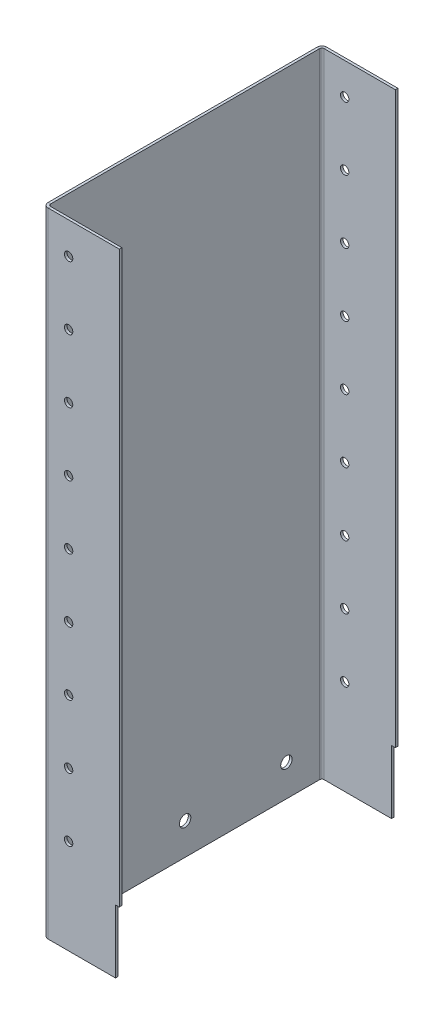
from build123d import *

# Parameters (mm, degrees)
SKETCH_1_W                         = 2
SKETCH_1_H                         = 500
SM_BASE_FLANGE_1_DEPTH             = 220
SM_EDGE_FLANGE_1_STRIP_W           = 11.6
SM_EDGE_FLANGE_1_STRIP_H           = 2
SM_EDGE_FLANGE_1_STRIP_CUT_DEPTH   = 500
SM_EDGE_FLANGE_1_STRIP_2_W         = 11.6
SM_EDGE_FLANGE_1_STRIP_2_H         = 2
SM_EDGE_FLANGE_1_STRIP_CUT_2_DEPTH = 500
SM_EDGE_FLANGE_1_DEPTH             = 500
SM_EDGE_FLANGE_1_BEND_DEPTH        = 500
SKETCH_10_W                        = 3
SKETCH_10_H                        = 50
CUT_EXTRUDE_1_DEPTH                = 550.545266561
HOLE_WIZARD_M81_D                  = 9
HOLE_WIZARD_M81_DEPTH              = 5
HOLE_WIZARD_M81_TIP                = 2.703872786
HOLE_WIZARD_M61_D                  = 6.6


# Sheet-metal steps are written as plain solids
with BuildPart() as part:
    # Sketch 1 → Базовая кромка1 (new body)
    with BuildSketch(Plane.XY):
        with Locations((1, 250)):
            Rectangle(SKETCH_1_W, SKETCH_1_H)
    extrude(amount=SM_BASE_FLANGE_1_DEPTH)

    # Ребро-кромка1 strip (across the edge) → Ребро-кромка1 strip cut (cut)
    with BuildSketch(Plane(origin=(2, 0, 0), x_dir=(0, 0, 1), z_dir=(0, 1, 0))):
        with Locations((-2, -1)):
            Rectangle(SM_EDGE_FLANGE_1_STRIP_W, SM_EDGE_FLANGE_1_STRIP_H)
    extrude(amount=SM_EDGE_FLANGE_1_STRIP_CUT_DEPTH, mode=Mode.SUBTRACT)

    # Ребро-кромка1 strip 2 (across the edge) → Ребро-кромка1 strip cut 2 (cut)
    with BuildSketch(Plane(origin=(2, 500, 220), x_dir=(0, 0, -1), z_dir=(0, -1, 0))):
        with Locations((-2, -1)):
            Rectangle(SM_EDGE_FLANGE_1_STRIP_2_W, SM_EDGE_FLANGE_1_STRIP_2_H)
    extrude(amount=SM_EDGE_FLANGE_1_STRIP_CUT_2_DEPTH, mode=Mode.SUBTRACT)

    # Ребро-кромка1 section (across the edge) → Ребро-кромка1 (add)
    with BuildSketch(Plane(origin=(2, 0, 0), x_dir=(0, 0, 1), z_dir=(0, 1, 0))):
        with BuildLine():
            Line((0, 1.8), (0, 58))
            Line((0, 58), (2, 58))
            Line((2, 58), (2, 1.8))
            ThreePointArc((2, 1.8), (2.527207794, 0.527207794), (3.8, 0))
            Line((3.8, 0), (3.8, -2))
            ThreePointArc((3.8, -2), (1.112994231, -0.887005769), (0, 1.8))
        make_face()
    extrude(amount=SM_EDGE_FLANGE_1_DEPTH)

    # Ребро-кромка1 section 2 (across the edge) → Ребро-кромка1 bend (add)
    with BuildSketch(Plane(origin=(2, 500, 220), x_dir=(0, 0, -1), z_dir=(0, -1, 0))):
        with BuildLine():
            Line((0, 1.8), (0, 58))
            Line((0, 58), (2, 58))
            Line((2, 58), (2, 1.8))
            ThreePointArc((2, 1.8), (2.527207794, 0.527207794), (3.8, 0))
            Line((3.8, 0), (3.8, -2))
            ThreePointArc((3.8, -2), (1.112994231, -0.887005769), (0, 1.8))
        make_face()
    extrude(amount=SM_EDGE_FLANGE_1_BEND_DEPTH)

    # Эскиз10 → Вырез-Вытянуть1 (cut, through all)
    with BuildSketch(Plane(origin=(0, 0, 0), x_dir=(-1, 0, 0), z_dir=(0, 0, -1))):
        with Locations((-58.5, 25)):
            Rectangle(SKETCH_10_W, SKETCH_10_H)
    extrude(amount=-CUT_EXTRUDE_1_DEPTH, mode=Mode.SUBTRACT)

    # Отверстие с зазором M81
    with Locations(Plane(origin=(2, 0, 0), x_dir=(0, 0, -1), z_dir=(1, 0, 0))):
        with Locations((-30, 25), (-110, 25), (-190, 25)):
            Hole(HOLE_WIZARD_M81_D / 2, depth=HOLE_WIZARD_M81_DEPTH)
            with Locations((0, 0, -(HOLE_WIZARD_M81_DEPTH + HOLE_WIZARD_M81_TIP / 2))):  # 118° drill point
                Cone(0, HOLE_WIZARD_M81_D / 2, HOLE_WIZARD_M81_TIP, mode=Mode.SUBTRACT)

    # Отверстие с зазором M61 (through all)
    with Locations(Plane(origin=(0, 0, 0), x_dir=(-1, 0, 0), z_dir=(0, 0, -1))):
        with Locations((-20, 475), (-20, 425), (-20, 375), (-20, 325), (-20, 275), (-20, 225), (-20, 175), (-20, 125), (-20, 75)):
            Hole(HOLE_WIZARD_M61_D / 2)


solid = part.part
